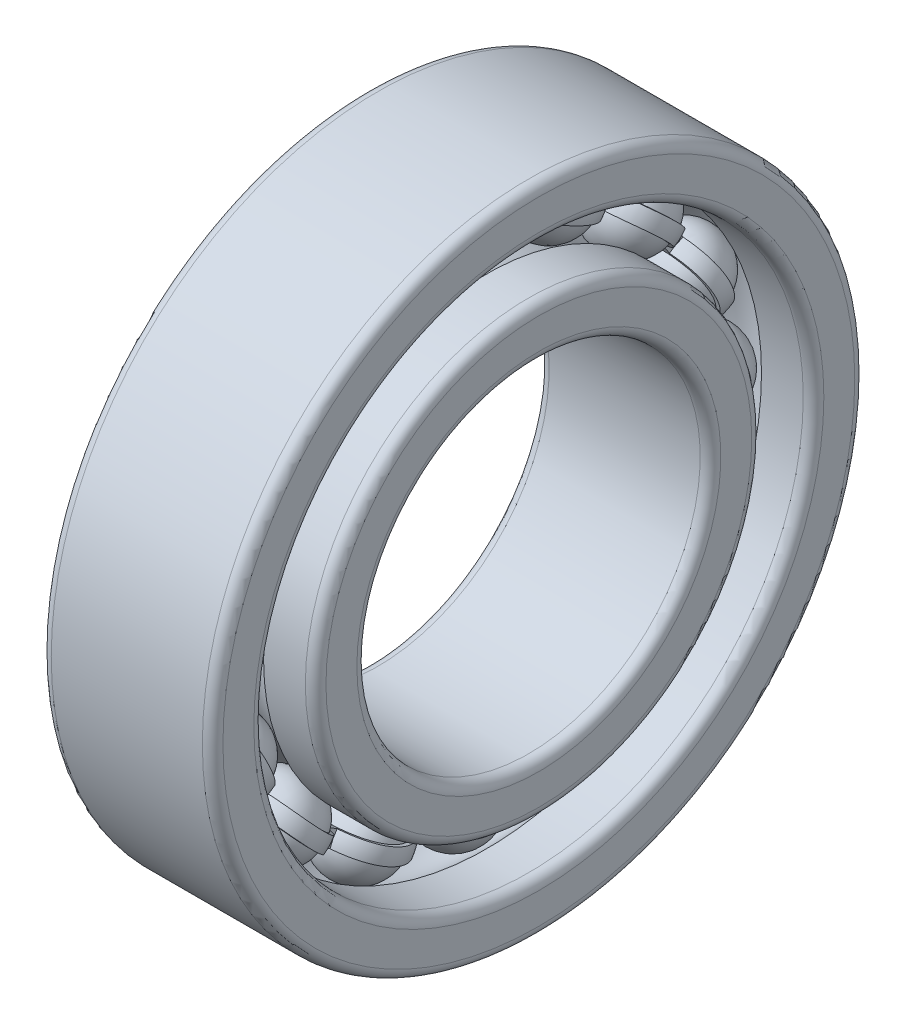
from build123d import *

# Parameters (mm, degrees)
SKETCH_5_W               = 0.6749999999999999
SKETCH_5_H               = 0.4499999999999993
PATTERN_CIRCULAR_5_COUNT = 16
PATTERN_CIRCULAR_2_COUNT = 16


with BuildPart() as part:
    # 草图2 → 旋转1 (revolve)
    with BuildSketch(Plane.XY):
        with BuildLine():
            Line((2.200000000000003, 5), (-2.199999999999999, 5))
            ThreePointArc((-2.199999999999999, 5), (-2.4121320343559622, 5.087867965644035), (-2.499999999999998, 5.299999999999999))
            Line((-2.499999999999998, 5.299999999999999), (-2.4999999999999987, 6.200000000000001))
            ThreePointArc((-2.4999999999999987, 6.200000000000001), (-2.4121320343559627, 6.412132034355965), (-2.199999999999999, 6.5))
            Line((-2.199999999999999, 6.5), (-0.8385254915624176, 6.499999999999999))
            ThreePointArc((-0.8385254915624176, 6.499999999999999), (7.8e-16, 6.125), (0.8385254915624176, 6.499999999999999))
            Line((0.8385254915624176, 6.499999999999999), (2.2000000000000033, 6.5))
            ThreePointArc((2.2000000000000033, 6.5), (2.412132034355967, 6.412132034355964), (2.5000000000000027, 6.2))
            Line((2.5000000000000027, 6.2), (2.500000000000002, 5.3))
            ThreePointArc((2.500000000000002, 5.3), (2.412132034355967, 5.087867965644036), (2.200000000000003, 5))
        make_face()
        with BuildLine():
            Line((-2.499999999999999, 9.2), (-2.499999999999998, 8.3))
            ThreePointArc((-2.499999999999998, 8.3), (-2.4121320343559622, 8.087867965644037), (-2.1999999999999984, 8))
            Line((-2.1999999999999984, 8), (-0.8385254915624204, 7.999999999999998))
            ThreePointArc((-0.8385254915624204, 7.999999999999998), (5.3e-16, 8.374999999999996), (0.8385254915624204, 7.999999999999998))
            Line((0.8385254915624204, 7.999999999999998), (2.2000000000000033, 8))
            ThreePointArc((2.2000000000000033, 8), (2.412132034355968, 8.087867965644035), (2.500000000000002, 8.3))
            Line((2.500000000000002, 8.3), (2.500000000000003, 9.2))
            ThreePointArc((2.500000000000003, 9.2), (2.412132034355967, 9.412132034355965), (2.2000000000000024, 9.500000000000002))
            Line((2.2000000000000024, 9.500000000000002), (-2.199999999999998, 9.500000000000002))
            ThreePointArc((-2.199999999999998, 9.500000000000002), (-2.412132034355964, 9.412132034355965), (-2.499999999999999, 9.2))
        make_face()
    revolve(axis=Axis((-3.4999999999999996, 0, 0), (1, 0, 0)))


with BuildPart() as body_2:
    # 草图5 → 旋转3 (revolve)
    with BuildSketch(Plane.XY):
        with Locations((3.94e-15, 7.250000000000002)):
            Rectangle(SKETCH_5_W, SKETCH_5_H)
    revolve(axis=Axis((-19.927092192426834, 0, 0), (1, 0, 0)))



with BuildPart() as body_3:
    # 草图3 → 旋转2 (revolve)
    with BuildSketch(Plane.XY):
        with BuildLine():
            ThreePointArc((1.2374999999999974, 7.25), (0, 8.487499999999995), (-1.2374999999999974, 7.25))
            Line((-1.2374999999999976, 7.25), (1.2374999999999976, 7.25))
        make_face()
    revolve(axis=Axis((-1.2374999999999976, 7.25, 0), (1, 0, 0)))


with BuildPart() as pattern_circular_5_1:
    # 阵列(圆周)5: pattern copy
    add(body_3.part.rotate(Axis((-3.850000000000002, 0, 0), (1, 0, 0)), 1 * 360 / PATTERN_CIRCULAR_5_COUNT))


with BuildPart() as pattern_circular_5_2:
    # 阵列(圆周)5: pattern copy
    add(body_3.part.rotate(Axis((-3.850000000000002, 0, 0), (1, 0, 0)), 2 * 360 / PATTERN_CIRCULAR_5_COUNT))


with BuildPart() as pattern_circular_5_3:
    # 阵列(圆周)5: pattern copy
    add(body_3.part.rotate(Axis((-3.850000000000002, 0, 0), (1, 0, 0)), 3 * 360 / PATTERN_CIRCULAR_5_COUNT))


with BuildPart() as pattern_circular_5_4:
    # 阵列(圆周)5: pattern copy
    add(body_3.part.rotate(Axis((-3.850000000000002, 0, 0), (1, 0, 0)), 4 * 360 / PATTERN_CIRCULAR_5_COUNT))


with BuildPart() as pattern_circular_5_5:
    # 阵列(圆周)5: pattern copy
    add(body_3.part.rotate(Axis((-3.850000000000002, 0, 0), (1, 0, 0)), 5 * 360 / PATTERN_CIRCULAR_5_COUNT))


with BuildPart() as pattern_circular_5_6:
    # 阵列(圆周)5: pattern copy
    add(body_3.part.rotate(Axis((-3.850000000000002, 0, 0), (1, 0, 0)), 6 * 360 / PATTERN_CIRCULAR_5_COUNT))


with BuildPart() as pattern_circular_5_7:
    # 阵列(圆周)5: pattern copy
    add(body_3.part.rotate(Axis((-3.850000000000002, 0, 0), (1, 0, 0)), 7 * 360 / PATTERN_CIRCULAR_5_COUNT))


with BuildPart() as pattern_circular_5_8:
    # 阵列(圆周)5: pattern copy
    add(body_3.part.rotate(Axis((-3.850000000000002, 0, 0), (1, 0, 0)), 8 * 360 / PATTERN_CIRCULAR_5_COUNT))


with BuildPart() as pattern_circular_5_9:
    # 阵列(圆周)5: pattern copy
    add(body_3.part.rotate(Axis((-3.850000000000002, 0, 0), (1, 0, 0)), 9 * 360 / PATTERN_CIRCULAR_5_COUNT))


with BuildPart() as pattern_circular_5_10:
    # 阵列(圆周)5: pattern copy
    add(body_3.part.rotate(Axis((-3.850000000000002, 0, 0), (1, 0, 0)), 10 * 360 / PATTERN_CIRCULAR_5_COUNT))


with BuildPart() as pattern_circular_5_11:
    # 阵列(圆周)5: pattern copy
    add(body_3.part.rotate(Axis((-3.850000000000002, 0, 0), (1, 0, 0)), 11 * 360 / PATTERN_CIRCULAR_5_COUNT))


with BuildPart() as pattern_circular_5_12:
    # 阵列(圆周)5: pattern copy
    add(body_3.part.rotate(Axis((-3.850000000000002, 0, 0), (1, 0, 0)), 12 * 360 / PATTERN_CIRCULAR_5_COUNT))


with BuildPart() as pattern_circular_5_13:
    # 阵列(圆周)5: pattern copy
    add(body_3.part.rotate(Axis((-3.850000000000002, 0, 0), (1, 0, 0)), 13 * 360 / PATTERN_CIRCULAR_5_COUNT))


with BuildPart() as pattern_circular_5_14:
    # 阵列(圆周)5: pattern copy
    add(body_3.part.rotate(Axis((-3.850000000000002, 0, 0), (1, 0, 0)), 14 * 360 / PATTERN_CIRCULAR_5_COUNT))


with BuildPart() as pattern_circular_5_15:
    # 阵列(圆周)5: pattern copy
    add(body_3.part.rotate(Axis((-3.850000000000002, 0, 0), (1, 0, 0)), 15 * 360 / PATTERN_CIRCULAR_5_COUNT))


with BuildPart() as cut_revolve_1_tool:
    # 草图6 → 切除-旋转1 (revolve)
    with BuildSketch(Plane.XY):
        with BuildLine():
            Line((-1.216873555469094, 7.4750000000000005), (1.216873555469094, 7.4750000000000005))
            ThreePointArc((1.216873555469094, 7.4750000000000005), (1.99e-15, 8.487499999999995), (-1.216873555469094, 7.4750000000000005))
        make_face()
        with BuildLine():
            Line((-1.216873555469094, 7.025), (1.216873555469094, 7.025))
            ThreePointArc((1.216873555469094, 7.025), (1.99e-15, 6.0125), (-1.216873555469094, 7.025))
        make_face()
    revolve(axis=Axis((-19.927092192426834, 0, 0), (1, 0, 0)))


with BuildPart() as part_1:
    add(part.part)

    # 切除-旋转1: cut by cut_revolve_1_tool
    add(cut_revolve_1_tool.part, mode=Mode.SUBTRACT)


with BuildPart() as body_3_1:
    add(body_3.part)

    # 切除-旋转1: cut by cut_revolve_1_tool
    add(cut_revolve_1_tool.part, mode=Mode.SUBTRACT)


with BuildPart() as pattern_circular_5_1_1:
    add(pattern_circular_5_1.part)

    # 切除-旋转1: cut by cut_revolve_1_tool
    add(cut_revolve_1_tool.part, mode=Mode.SUBTRACT)


with BuildPart() as pattern_circular_5_2_1:
    add(pattern_circular_5_2.part)

    # 切除-旋转1: cut by cut_revolve_1_tool
    add(cut_revolve_1_tool.part, mode=Mode.SUBTRACT)


with BuildPart() as pattern_circular_5_3_1:
    add(pattern_circular_5_3.part)

    # 切除-旋转1: cut by cut_revolve_1_tool
    add(cut_revolve_1_tool.part, mode=Mode.SUBTRACT)


with BuildPart() as pattern_circular_5_4_1:
    add(pattern_circular_5_4.part)

    # 切除-旋转1: cut by cut_revolve_1_tool
    add(cut_revolve_1_tool.part, mode=Mode.SUBTRACT)


with BuildPart() as pattern_circular_5_5_1:
    add(pattern_circular_5_5.part)

    # 切除-旋转1: cut by cut_revolve_1_tool
    add(cut_revolve_1_tool.part, mode=Mode.SUBTRACT)


with BuildPart() as pattern_circular_5_6_1:
    add(pattern_circular_5_6.part)

    # 切除-旋转1: cut by cut_revolve_1_tool
    add(cut_revolve_1_tool.part, mode=Mode.SUBTRACT)


with BuildPart() as pattern_circular_5_7_1:
    add(pattern_circular_5_7.part)

    # 切除-旋转1: cut by cut_revolve_1_tool
    add(cut_revolve_1_tool.part, mode=Mode.SUBTRACT)


with BuildPart() as pattern_circular_5_8_1:
    add(pattern_circular_5_8.part)

    # 切除-旋转1: cut by cut_revolve_1_tool
    add(cut_revolve_1_tool.part, mode=Mode.SUBTRACT)


with BuildPart() as pattern_circular_5_9_1:
    add(pattern_circular_5_9.part)

    # 切除-旋转1: cut by cut_revolve_1_tool
    add(cut_revolve_1_tool.part, mode=Mode.SUBTRACT)


with BuildPart() as pattern_circular_5_10_1:
    add(pattern_circular_5_10.part)

    # 切除-旋转1: cut by cut_revolve_1_tool
    add(cut_revolve_1_tool.part, mode=Mode.SUBTRACT)


with BuildPart() as pattern_circular_5_11_1:
    add(pattern_circular_5_11.part)

    # 切除-旋转1: cut by cut_revolve_1_tool
    add(cut_revolve_1_tool.part, mode=Mode.SUBTRACT)


with BuildPart() as pattern_circular_5_12_1:
    add(pattern_circular_5_12.part)

    # 切除-旋转1: cut by cut_revolve_1_tool
    add(cut_revolve_1_tool.part, mode=Mode.SUBTRACT)


with BuildPart() as pattern_circular_5_13_1:
    add(pattern_circular_5_13.part)

    # 切除-旋转1: cut by cut_revolve_1_tool
    add(cut_revolve_1_tool.part, mode=Mode.SUBTRACT)


with BuildPart() as pattern_circular_5_14_1:
    add(pattern_circular_5_14.part)

    # 切除-旋转1: cut by cut_revolve_1_tool
    add(cut_revolve_1_tool.part, mode=Mode.SUBTRACT)


with BuildPart() as pattern_circular_5_15_1:
    add(pattern_circular_5_15.part)

    # 切除-旋转1: cut by cut_revolve_1_tool
    add(cut_revolve_1_tool.part, mode=Mode.SUBTRACT)


with BuildPart() as body_2_1:
    add(body_2.part)

    add(body_3_1.part)  # 旋转4 merges body 3
    # 草图7 → 旋转4 (revolve)
    with BuildSketch(Plane.XY):
        with BuildLine():
            Line((-1.1249999999999978, 7.25), (1.1249999999999978, 7.25))
            ThreePointArc((1.1249999999999978, 7.25), (2.53e-15, 8.374999999999995), (-1.1249999999999978, 7.25))
        make_face()
    revolve_4 = revolve(axis=Axis((-1.1249999999999978, 7.25, 0), (1, 0, 0)))

    # 阵列(圆周)2: 旋转4 ×16 about axis
    pattern_circular_2_axis = Axis((-3.850000000000002, 0, 0), (1, 0, 0))
    for i in range(1, PATTERN_CIRCULAR_2_COUNT):
        add(revolve_4.rotate(pattern_circular_2_axis, i * 360 / PATTERN_CIRCULAR_2_COUNT))


solid = Compound([part_1.part, pattern_circular_5_1_1.part, pattern_circular_5_2_1.part, pattern_circular_5_3_1.part, pattern_circular_5_4_1.part, pattern_circular_5_5_1.part, pattern_circular_5_6_1.part, pattern_circular_5_7_1.part, pattern_circular_5_8_1.part, pattern_circular_5_9_1.part, pattern_circular_5_10_1.part, pattern_circular_5_11_1.part, pattern_circular_5_12_1.part, pattern_circular_5_13_1.part, pattern_circular_5_14_1.part, pattern_circular_5_15_1.part, body_2_1.part])
